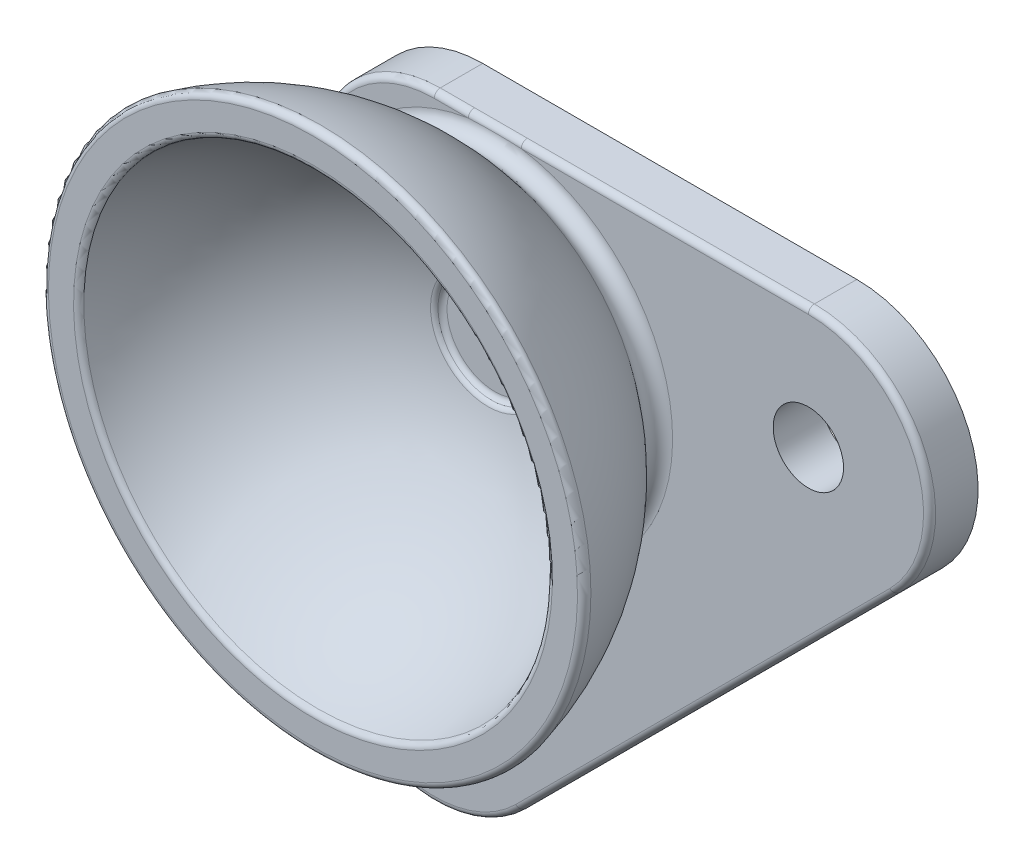
from build123d import *

# Parameters (mm, degrees)
BOSS_EXTRUDE1_DEPTH  = 4
M5_CLEARANCE_HOLE1_D = 5.8
CUT_EXTRUDE1_DEPTH   = 94.139680051
CUT_EXTRUDE2_DEPTH   = 84.883981599
FILLET1_R            = 10
FILLET2_R            = 1
FILLET3_R            = 0.5
FILLET4_R            = 0.5
FILLET5_R            = 0.5


with BuildPart() as part:
    # Sketch1 → Boss-Extrude1 (new body)
    with BuildSketch(Plane.XY):
        Polygon((0, 0), (65, 0), (0, -65), align=None)
    extrude(amount=BOSS_EXTRUDE1_DEPTH)

    # Sketch2 → Revolve2 (revolve)
    with BuildSketch(Plane(origin=(15, 0, 0), x_dir=(0, 0, -1), z_dir=(1, 0, 0))):
        with BuildLine():
            Line((-19, -37.449944321), (-19, -34.364916731))
            ThreePointArc((-19, -34.364916731), (-9.657050031, -28.938428398), (-4.5, -19.444097209))
            Line((-4.5, -19.444097209), (-4, -19.444097209))
            Line((-4, -19.444097209), (-4, -26.357816692))
            ThreePointArc((-4, -26.357816692), (-10.324883041, -33.493003438), (-19, -37.449944321))
        make_face()
    revolve(axis=Axis((15, -15, 4), (0, 0, 1)))

    # M5 Clearance Hole1 (through all)
    with Locations(Plane.XY.offset(4)):
        with Locations((10, -40.857864376), (40.857864376, -10)):
            Hole(M5_CLEARANCE_HOLE1_D / 2)

    # Sketch6 → Cut-Extrude1 (cut, through all)
    with BuildSketch(Plane.XY.offset(4)):
        with BuildLine():
            Line((0, -40.857864376), (0, -65))
            Line((0, -65), (17.071067812, -47.928932188))
            ThreePointArc((17.071067812, -47.928932188), (6.173165676, -50.096659701), (0, -40.857864376))
        make_face()
    extrude(amount=-CUT_EXTRUDE1_DEPTH, mode=Mode.SUBTRACT)

    # Sketch7 → Cut-Extrude2 (cut, through all)
    with BuildSketch(Plane.XY.offset(4)):
        with BuildLine():
            Line((40.857864376, 0), (65, 0))
            Line((65, 0), (47.928932188, -17.071067812))
            ThreePointArc((47.928932188, -17.071067812), (50.096659701, -6.173165676), (40.857864376, 0))
        make_face()
    extrude(amount=-CUT_EXTRUDE2_DEPTH, mode=Mode.SUBTRACT)

    # Fillet1
    fillet1_edges = [part.edges().sort_by_distance(p)[0] for p in [
        (0, 0, 2),
    ]]
    fillet(fillet1_edges, radius=FILLET1_R)

    # Fillet2
    fillet2_edges = [part.edges().sort_by_distance(p)[0] for p in [
        (15, -3.642183308, 4),
    ]]
    fillet(fillet2_edges, radius=FILLET2_R)

    # Fillet3
    fillet3_edges = [part.edges().sort_by_distance(p)[0] for p in [
        (15, -10.555902791, 4),
    ]]
    fillet(fillet3_edges, radius=FILLET3_R - 0.0001)  # a hair under: the kernel refuses the full size

    # Fillet4
    fillet4_edges = [part.edges().sort_by_distance(p)[0] for p in [
        (15, -10.555902791, 4.5),
        (15, 4.364916731, 19),
        (15, 7.449944321, 19),
    ]]
    fillet(fillet4_edges, radius=FILLET4_R)

    # Fillet5
    fillet5_edges = [part.edges().sort_by_distance(p)[0] for p in [
        (32.5, -32.5, 4),
        (6.173165676, -50.096659701, 4),
        (25.428932188, 0, 4),
        (50.096659701, -6.173165676, 4),
        (0, -25.428932188, 4),
        (2.928932188, -2.928932188, 4),
    ]]
    fillet(fillet5_edges, radius=FILLET5_R)


solid = part.part
